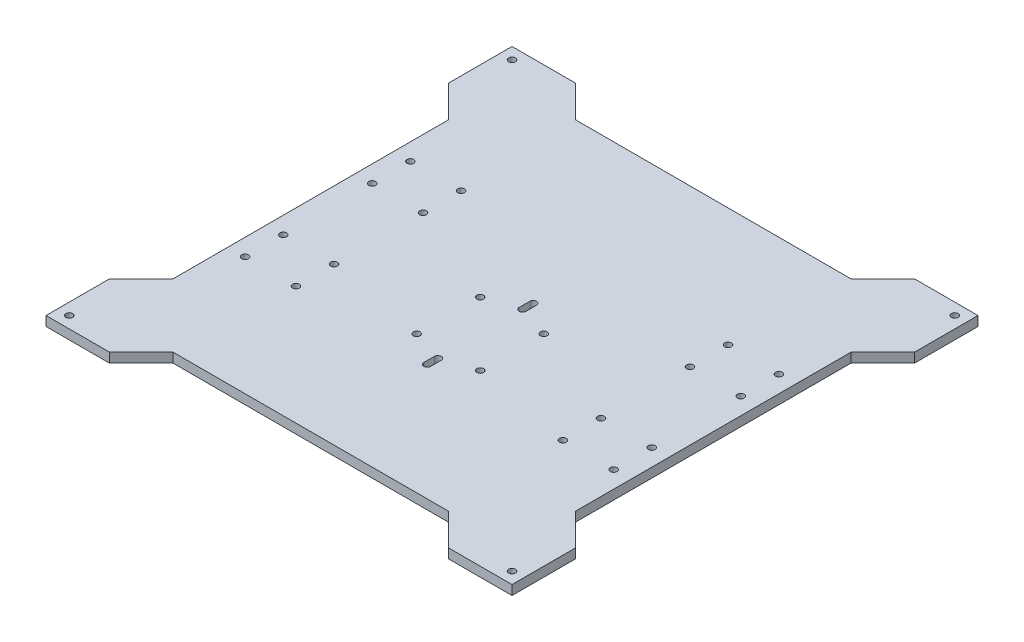
from build123d import *

# Parameters (mm, degrees)
SKETCH1_W           = 220
SKETCH1_H           = 220
SQUARE_DEPTH        = 4.5
SKETCH2_R           = 1.6
LM8UU_HOLDERS_DEPTH = 156.628564216
SKETCH3_R           = 1.6
DEFAULTBELT_DEPTH   = 156.628564216
BELTOPTIONS_DEPTH   = 156.628564216
SKETCH5_OUTSIDE_W   = 284.232
SKETCH5_OUTSIDE_H   = 284.232
SKETCH5_OUTSIDE_R   = 1.6
SHAPING_DEPTH       = 10
SKETCH6_R           = 1.6
CUT_EXTRUDE5_DEPTH  = 156.628564216


with BuildPart() as part:
    # Sketch1 → Square (new body)
    with BuildSketch(Plane(origin=(0, 0, 0), x_dir=(1, 0, 0), z_dir=(0, 1, 0))):
        Rectangle(SKETCH1_W, SKETCH1_H)
    extrude(amount=SQUARE_DEPTH)

    # Sketch2 → LM8UU-Holders (cut, through all)
    with BuildSketch(Plane(origin=(0, 4.5, 0), x_dir=(1, 0, 0), z_dir=(0, 1, 0))):
        with Locations((87, 39)):
            Circle(SKETCH2_R)
        with Locations((87, 21)):
            Circle(SKETCH2_R)
        with Locations((63, 21)):
            Circle(SKETCH2_R)
        with Locations((63, 39)):
            Circle(SKETCH2_R)
        with Locations((-63, 39)):
            Circle(SKETCH2_R)
        with Locations((-63, 21)):
            Circle(SKETCH2_R)
        with Locations((-87, 21)):
            Circle(SKETCH2_R)
        with Locations((-87, 39)):
            Circle(SKETCH2_R)
        with Locations((87, -21)):
            Circle(SKETCH2_R)
        with Locations((87, -39)):
            Circle(SKETCH2_R)
        with Locations((63, -39)):
            Circle(SKETCH2_R)
        with Locations((63, -21)):
            Circle(SKETCH2_R)
        with Locations((-63, -21)):
            Circle(SKETCH2_R)
        with Locations((-63, -39)):
            Circle(SKETCH2_R)
        with Locations((-87, -39)):
            Circle(SKETCH2_R)
        with Locations((-87, -21)):
            Circle(SKETCH2_R)
    extrude(amount=-LM8UU_HOLDERS_DEPTH, mode=Mode.SUBTRACT)

    # Sketch3 → DefaultBelt (cut, through all)
    with BuildSketch(Plane(origin=(0, 4.5, 0), x_dir=(1, 0, 0), z_dir=(0, 1, 0))):
        with Locations((-15, -30)):
            Circle(SKETCH3_R)
        with Locations((15, -30)):
            Circle(SKETCH3_R)
        with Locations((15, 0)):
            Circle(SKETCH3_R)
        with Locations((-15, 0)):
            Circle(SKETCH3_R)
    extrude(amount=-DEFAULTBELT_DEPTH, mode=Mode.SUBTRACT)

    # Sketch4 → BeltOptions (cut, through all)
    with BuildSketch(Plane(origin=(0, 4.5, 0), x_dir=(1, 0, 0), z_dir=(0, 1, 0))):
        with BuildLine():
            Line((1.6, 10), (1.6, 5))
            ThreePointArc((1.6, 5), (0, 3.4), (-1.6, 5))
            Line((-1.6, 5), (-1.6, 10))
            ThreePointArc((-1.6, 10), (0, 11.6), (1.6, 10))
        make_face()
        with BuildLine():
            Line((1.6, -40), (1.6, -35))
            ThreePointArc((1.6, -35), (0, -33.4), (-1.6, -35))
            Line((-1.6, -35), (-1.6, -40))
            ThreePointArc((-1.6, -40), (0, -41.6), (1.6, -40))
        make_face()
    extrude(amount=-BELTOPTIONS_DEPTH, mode=Mode.SUBTRACT)

    # Sketch5 outside → Shaping (cut)
    # profile 1 of 15: a face of its own
    with BuildSketch(Plane(origin=(0, 4.5, 0), x_dir=(1, 0, 0), z_dir=(0, 1, 0))):
        Rectangle(SKETCH5_OUTSIDE_W, SKETCH5_OUTSIDE_H)
        Polygon((-80, 110), (-110, 110), (-110, 80), (-95, 65), (-95, -65), (-110, -80), (-110, -110), (-80, -110), (-65, -95), (65, -95), (80, -110), (110, -110), (110, -80), (95, -65), (95, 65), (110, 80), (110, 110), (80, 110), (65, 95), (-65, 95), align=None, mode=Mode.SUBTRACT)
    # profile 2 of 15: a face of its own
    with BuildSketch(Plane(origin=(0, 4.5, 0), x_dir=(1, 0, 0), z_dir=(0, 1, 0))):
        with Locations((-87, -39)):
            Circle(SKETCH5_OUTSIDE_R)
    # profile 3 of 15: a face of its own
    with BuildSketch(Plane(origin=(0, 4.5, 0), x_dir=(1, 0, 0), z_dir=(0, 1, 0))):
        with Locations((-63, -39)):
            Circle(SKETCH5_OUTSIDE_R)
    # profile 4 of 15: a face of its own
    with BuildSketch(Plane(origin=(0, 4.5, 0), x_dir=(1, 0, 0), z_dir=(0, 1, 0))):
        with Locations((-87, -21)):
            Circle(SKETCH5_OUTSIDE_R)
    # profile 5 of 15: a face of its own
    with BuildSketch(Plane(origin=(0, 4.5, 0), x_dir=(1, 0, 0), z_dir=(0, 1, 0))):
        with Locations((-63, -21)):
            Circle(SKETCH5_OUTSIDE_R)
    # profile 6 of 15: a face of its own
    with BuildSketch(Plane(origin=(0, 4.5, 0), x_dir=(1, 0, 0), z_dir=(0, 1, 0))):
        with Locations((15, -30)):
            Circle(SKETCH5_OUTSIDE_R)
    # profile 7 of 15: a face of its own
    with BuildSketch(Plane(origin=(0, 4.5, 0), x_dir=(1, 0, 0), z_dir=(0, 1, 0))):
        with Locations((63, -39)):
            Circle(SKETCH5_OUTSIDE_R)
    # profile 8 of 15: a face of its own
    with BuildSketch(Plane(origin=(0, 4.5, 0), x_dir=(1, 0, 0), z_dir=(0, 1, 0))):
        with Locations((87, -39)):
            Circle(SKETCH5_OUTSIDE_R)
    # profile 9 of 15: a face of its own
    with BuildSketch(Plane(origin=(0, 4.5, 0), x_dir=(1, 0, 0), z_dir=(0, 1, 0))):
        with Locations((63, -21)):
            Circle(SKETCH5_OUTSIDE_R)
    # profile 10 of 15: a face of its own
    with BuildSketch(Plane(origin=(0, 4.5, 0), x_dir=(1, 0, 0), z_dir=(0, 1, 0))):
        with Locations((-87, 21)):
            Circle(SKETCH5_OUTSIDE_R)
    # profile 11 of 15: a face of its own
    with BuildSketch(Plane(origin=(0, 4.5, 0), x_dir=(1, 0, 0), z_dir=(0, 1, 0))):
        with Locations((-63, 21)):
            Circle(SKETCH5_OUTSIDE_R)
    # profile 12 of 15: a face of its own
    with BuildSketch(Plane(origin=(0, 4.5, 0), x_dir=(1, 0, 0), z_dir=(0, 1, 0))):
        with Locations((-87, 39)):
            Circle(SKETCH5_OUTSIDE_R)
    # profile 13 of 15: a face of its own
    with BuildSketch(Plane(origin=(0, 4.5, 0), x_dir=(1, 0, 0), z_dir=(0, 1, 0))):
        with Locations((-63, 39)):
            Circle(SKETCH5_OUTSIDE_R)
    # profile 14 of 15: a face of its own
    with BuildSketch(Plane(origin=(0, 4.5, 0), x_dir=(1, 0, 0), z_dir=(0, 1, 0))):
        with Locations((87, 21)):
            Circle(SKETCH5_OUTSIDE_R)
    # profile 15 of 15: a face of its own
    with BuildSketch(Plane(origin=(0, 4.5, 0), x_dir=(1, 0, 0), z_dir=(0, 1, 0))):
        with Locations((63, 39)):
            Circle(SKETCH5_OUTSIDE_R)
    extrude(amount=-SHAPING_DEPTH, mode=Mode.SUBTRACT)

    # Sketch6 → Cut-Extrude5 (cut, through all)
    with BuildSketch(Plane(origin=(0, 4.5, 0), x_dir=(1, 0, 0), z_dir=(0, 1, 0))):
        with Locations((-104.5, 104.5)):
            Circle(SKETCH6_R)
        with Locations((104.5, 104.5)):
            Circle(SKETCH6_R)
        with Locations((104.5, -104.5)):
            Circle(SKETCH6_R)
        with Locations((-104.5, -104.5)):
            Circle(SKETCH6_R)
    extrude(amount=-CUT_EXTRUDE5_DEPTH, mode=Mode.SUBTRACT)


solid = part.part
